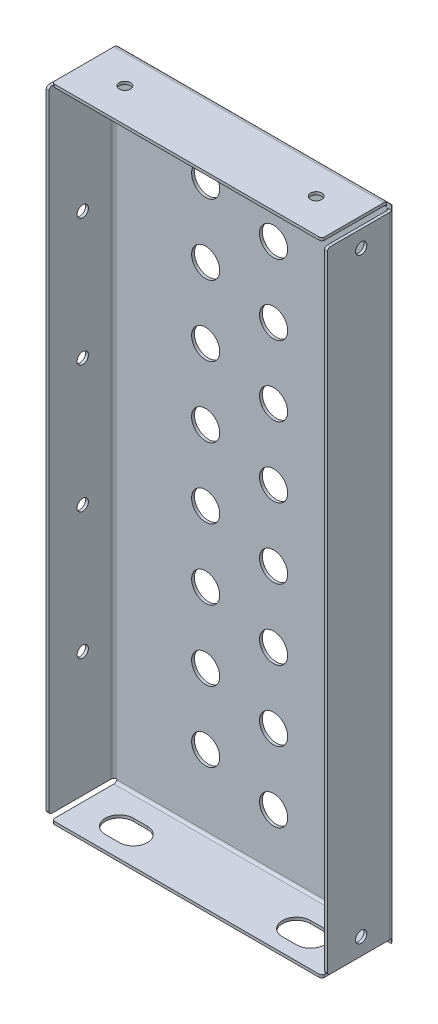
from build123d import *

# Parameters (mm, degrees)
SKETCH_1_W               = 100
SKETCH_1_H               = 228
EXTRUDE_1_DEPTH          = 1
SKETCH_2_W               = 96
SKETCH_2_H               = 1
SKETCH_2_W_2             = 1
SKETCH_2_H_2             = 224
EXTRUDE_2_DEPTH          = 23
FILLET_1_R               = 0.9
FILLET_2_R               = 1.9
CUT_EXTRUDE_1_DEPTH      = 22
CUT_EXTRUDE_1_DEPTH_BACK = 22
FILLET_3_R               = 1
SKETCH_4_R               = 5
CUT_EXTRUDE_2_DEPTH      = 10
SKETCH_5_R               = 2
CUT_EXTRUDE_3_DEPTH      = 30
SKETCH_6_R               = 2
CUT_EXTRUDE_4_DEPTH      = 30
SKETCH_7_R               = 2
CUT_EXTRUDE_5_DEPTH      = 30
SKETCH_8_R               = 2
CUT_EXTRUDE_6_DEPTH      = 30
CUT_EXTRUDE_7_DEPTH      = 10


with BuildPart() as part:
    # Эскиз1 → Бобышка-Вытянуть1 (new body)
    with BuildSketch(Plane.XY):
        with Locations((50, 114)):
            Rectangle(SKETCH_1_W, SKETCH_1_H)
    extrude(amount=EXTRUDE_1_DEPTH)

    # Эскиз2 → Бобышка-Вытянуть2 (add)
    with BuildSketch(Plane.XY.offset(1)):
        with Locations((50, 227.5)):
            Rectangle(SKETCH_2_W, SKETCH_2_H)
        with Locations((50, 0.5)):
            Rectangle(SKETCH_2_W, SKETCH_2_H)
        with Locations((99.5, 114)):
            Rectangle(SKETCH_2_W_2, SKETCH_2_H_2)
        with Locations((0.5, 114)):
            Rectangle(SKETCH_2_W_2, SKETCH_2_H_2)
    extrude(amount=EXTRUDE_2_DEPTH)

    # Скругление1
    fillet_1_edges = [part.edges().sort_by_distance(p)[0] for p in [
        (50, 227, 1),
        (50, 1, 1),
        (99, 114, 1),
        (1, 114, 1),
    ]]
    fillet(fillet_1_edges, radius=FILLET_1_R)

    # Скругление2
    # the kernel refuses this fillet: 1.9 mm, written as the material it takes off along each edge
    with BuildSketch(Plane(origin=(-4.75, 228, 0), x_dir=(0, -1, 0), z_dir=(1, 0, 0)), Plane(origin=(104.75, 0, 0), x_dir=(0, 1, 0), z_dir=(-1, 0, 0))) as fillet_2_piece_1:
        with BuildLine():
            CenterArc((FILLET_2_R, -FILLET_2_R), FILLET_2_R, 90, 90)
            Line((0, -FILLET_2_R), (0, 0))
            Line((0, 0), (FILLET_2_R, 0))
        make_face()
    extrude(amount=109.5, mode=Mode.SUBTRACT)
    with BuildSketch(Plane(origin=(100, 232.75, 0), x_dir=(-1, 0, 0), z_dir=(0, -1, 0))) as fillet_2_piece_2:
        with BuildLine():
            CenterArc((FILLET_2_R, -FILLET_2_R), FILLET_2_R, 90, 90)
            Line((0, -FILLET_2_R), (0, 0))
            Line((0, 0), (FILLET_2_R, 0))
        make_face()
    extrude(amount=237.5, mode=Mode.SUBTRACT)
    with BuildSketch(Plane(origin=(0, -4.75, 0), x_dir=(0, 0, 1), z_dir=(0, 1, 0))) as fillet_2_piece_3:
        with BuildLine():
            CenterArc((FILLET_2_R, FILLET_2_R), FILLET_2_R, 180, 90)
            Line((0, FILLET_2_R), (0, 0))
            Line((0, 0), (FILLET_2_R, 0))
        make_face()
    extrude(amount=237.5, mode=Mode.SUBTRACT)

    # Эскиз3 → Вырез-Вытянуть1 (cut, two sides: drawn at the far end of the back side and taken through both)
    with BuildSketch(Plane.XY.offset(1).offset(-CUT_EXTRUDE_1_DEPTH_BACK)):
        with BuildLine():
            Line((0.226679947, 226), (0.226679947, 227.773320053))
            Line((0.226679947, 227.773320053), (2, 227.773320053))
            Line((2, 227.773320053), (2, 226.329128785))
            ThreePointArc((2, 226.329128785), (2.076776695, 225.923223305), (1.670871215, 226))
            Line((1.670871215, 226), (0.226679947, 226))
        make_face()
        with BuildLine():
            Line((118, 226.329128785), (118, 227.773320053))
            Line((118, 227.773320053), (119.773320053, 227.773320053))
            Line((119.773320053, 227.773320053), (119.773320053, 226))
            Line((119.773320053, 226), (118.329128785, 226))
            ThreePointArc((118.329128785, 226), (117.923223305, 225.923223305), (118, 226.329128785))
        make_face()
        with BuildLine():
            Line((2, 1.670871215), (2, 0.226679947))
            Line((2, 0.226679947), (0.226679947, 0.226679947))
            Line((0.226679947, 0.226679947), (0.226679947, 2))
            Line((0.226679947, 2), (1.670871215, 2))
            ThreePointArc((1.670871215, 2), (2.076776695, 2.076776695), (2, 1.670871215))
        make_face()
        with BuildLine():
            Line((119.773320053, 2), (119.773320053, 0.226679947))
            Line((119.773320053, 0.226679947), (118, 0.226679947))
            Line((118, 0.226679947), (118, 1.670871215))
            ThreePointArc((118, 1.670871215), (117.923223305, 2.076776695), (118.329128785, 2))
            Line((118.329128785, 2), (119.773320053, 2))
        make_face()
    extrude(amount=CUT_EXTRUDE_1_DEPTH + CUT_EXTRUDE_1_DEPTH_BACK, mode=Mode.SUBTRACT)

    # Скругление3
    fillet_3_edges = [part.edges().sort_by_distance(p)[0] for p in [
        (98, 227.5, 24),
        (2, 227.5, 24),
        (98, 0.5, 24),
        (2, 0.5, 24),
        (99.5, 2, 24),
        (99.5, 226, 24),
        (0.5, 226, 24),
        (0.5, 2, 24),
    ]]
    fillet(fillet_3_edges, radius=FILLET_3_R)

    # Эскиз4 → Вырез-Вытянуть2 (cut)
    with BuildSketch(Plane.XY.offset(1)):
        with Locations((33.703708686, 202)):
            Circle(SKETCH_4_R)
        with Locations((33.703708686, 177)):
            Circle(SKETCH_4_R)
        with Locations((33.703708686, 152)):
            Circle(SKETCH_4_R)
        with Locations((33.703708686, 127)):
            Circle(SKETCH_4_R)
        with Locations((33.703708686, 102)):
            Circle(SKETCH_4_R)
        with Locations((33.703708686, 77)):
            Circle(SKETCH_4_R)
        with Locations((33.703708686, 52)):
            Circle(SKETCH_4_R)
        with Locations((33.703708686, 27)):
            Circle(SKETCH_4_R)
        with Locations((57.851854343, 20.529523872)):
            Circle(SKETCH_4_R)
        with Locations((57.851854343, 45.529523872)):
            Circle(SKETCH_4_R)
        with Locations((57.851854343, 70.529523872)):
            Circle(SKETCH_4_R)
        with Locations((57.851854343, 95.529523872)):
            Circle(SKETCH_4_R)
        with Locations((57.851854343, 120.529523872)):
            Circle(SKETCH_4_R)
        with Locations((57.851854343, 145.529523872)):
            Circle(SKETCH_4_R)
        with Locations((57.851854343, 170.529523872)):
            Circle(SKETCH_4_R)
        with Locations((57.851854343, 195.529523872)):
            Circle(SKETCH_4_R)
        with Locations((82, 202)):
            Circle(SKETCH_4_R)
        with Locations((82, 177)):
            Circle(SKETCH_4_R)
        with Locations((82, 152)):
            Circle(SKETCH_4_R)
        with Locations((82, 127)):
            Circle(SKETCH_4_R)
        with Locations((82, 102)):
            Circle(SKETCH_4_R)
        with Locations((82, 77)):
            Circle(SKETCH_4_R)
        with Locations((82, 52)):
            Circle(SKETCH_4_R)
        with Locations((82, 27)):
            Circle(SKETCH_4_R)
    extrude(amount=-CUT_EXTRUDE_2_DEPTH, mode=Mode.SUBTRACT)

    # Эскиз5 → Вырез-Вытянуть3 (cut)
    with BuildSketch(Plane(origin=(0, 228, 0), x_dir=(1, 0, 0), z_dir=(0, 1, 0))):
        with Locations(Location((16, -12, 0), (0, 0, 270))):
            Circle(SKETCH_5_R)
        with Locations(Location((84, -12, 0), (0, 0, 270))):
            Circle(SKETCH_5_R)
        with Locations((84, 252)):
            Circle(SKETCH_5_R)
        with Locations((16, 252)):
            Circle(SKETCH_5_R)
    extrude(amount=-CUT_EXTRUDE_3_DEPTH, mode=Mode.SUBTRACT)

    # Эскиз6 → Вырез-Вытянуть4 (cut)
    with BuildSketch(Plane(origin=(100, 0, 0), x_dir=(0, 0, -1), z_dir=(1, 0, 0))):
        with Locations((-12, 220)):
            Circle(SKETCH_6_R)
    extrude(amount=-CUT_EXTRUDE_4_DEPTH, mode=Mode.SUBTRACT)

    # Эскиз7 → Вырез-Вытянуть5 (cut)
    with BuildSketch(Plane(origin=(100, 0, 0), x_dir=(0, 0, -1), z_dir=(1, 0, 0))):
        with Locations((-12, 8)):
            Circle(SKETCH_7_R)
    extrude(amount=-CUT_EXTRUDE_5_DEPTH, mode=Mode.SUBTRACT)

    # Эскиз8 → Вырез-Вытянуть6 (cut)
    with BuildSketch(Plane.ZY):
        with Locations((12, 181.9)):
            Circle(SKETCH_8_R)
        with Locations((12, 46.3)):
            Circle(SKETCH_8_R)
        with Locations((12, 91.5)):
            Circle(SKETCH_8_R)
        with Locations((12, 136.7)):
            Circle(SKETCH_8_R)
    extrude(amount=-CUT_EXTRUDE_6_DEPTH, mode=Mode.SUBTRACT)

    # Эскиз9 → Вырез-Вытянуть7 (cut)
    with BuildSketch(Plane(origin=(0, 1, 0), x_dir=(1, 0, 0), z_dir=(0, 1, 0))):
        with BuildLine():
            Line((16, -9), (21, -9))
            ThreePointArc((21, -9), (26, -14), (21, -19))
            Line((21, -19), (16, -19))
            ThreePointArc((16, -19), (11, -14), (16, -9))
        make_face()
        with BuildLine():
            Line((84, -19), (79, -19))
            ThreePointArc((79, -19), (74, -14), (79, -9))
            Line((79, -9), (84, -9))
            ThreePointArc((84, -9), (89, -14), (84, -19))
        make_face()
    extrude(amount=-CUT_EXTRUDE_7_DEPTH, mode=Mode.SUBTRACT)


solid = part.part
